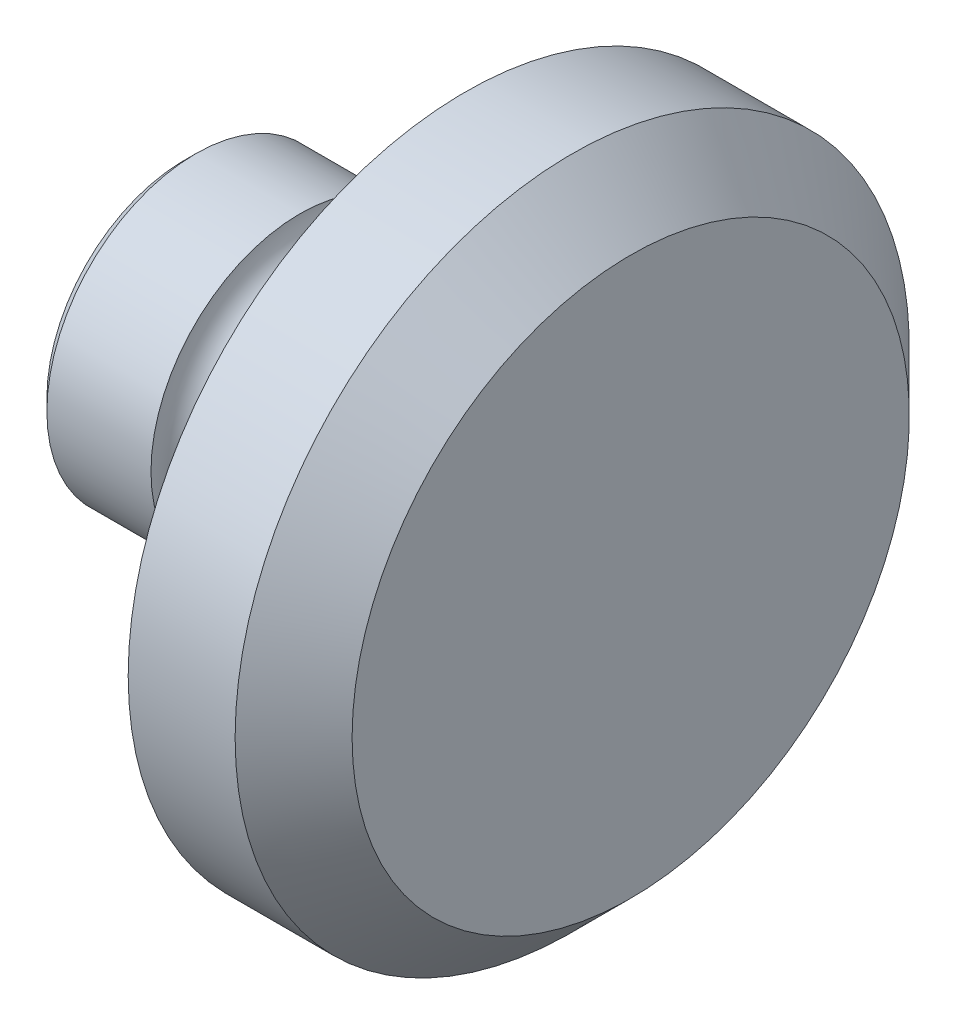
from build123d import *


with BuildPart() as part:
    # Sketch1 → Revolve1 (revolve)
    with BuildSketch(Plane.XY):
        with BuildLine():
            Line((-21.757414813, 9), (-22.464521594, 8.292893219))
            Line((-22.464521594, 8.292893219), (-22.464521594, 0))
            Line((-22.464521594, 0), (4.535478406, 0))
            Line((4.535478406, 0), (4.535478406, 16.842937843))
            Line((4.535478406, 16.842937843), (0.9999445, 20.378471749))
            Line((0.9999445, 20.378471749), (-5.464521594, 20.378471749))
            Line((-5.464521594, 20.378471749), (-5.464521594, 9))
            Line((-5.464521594, 9), (-11.464521594, 9))
            ThreePointArc((-11.464521594, 9), (-13.464521594, 7), (-15.464521594, 9))
            Line((-15.464521594, 9), (-21.757414813, 9))
        make_face()
    revolve(axis=Axis((-26.421046206, 0, 0), (1, 0, 0)))


solid = part.part
